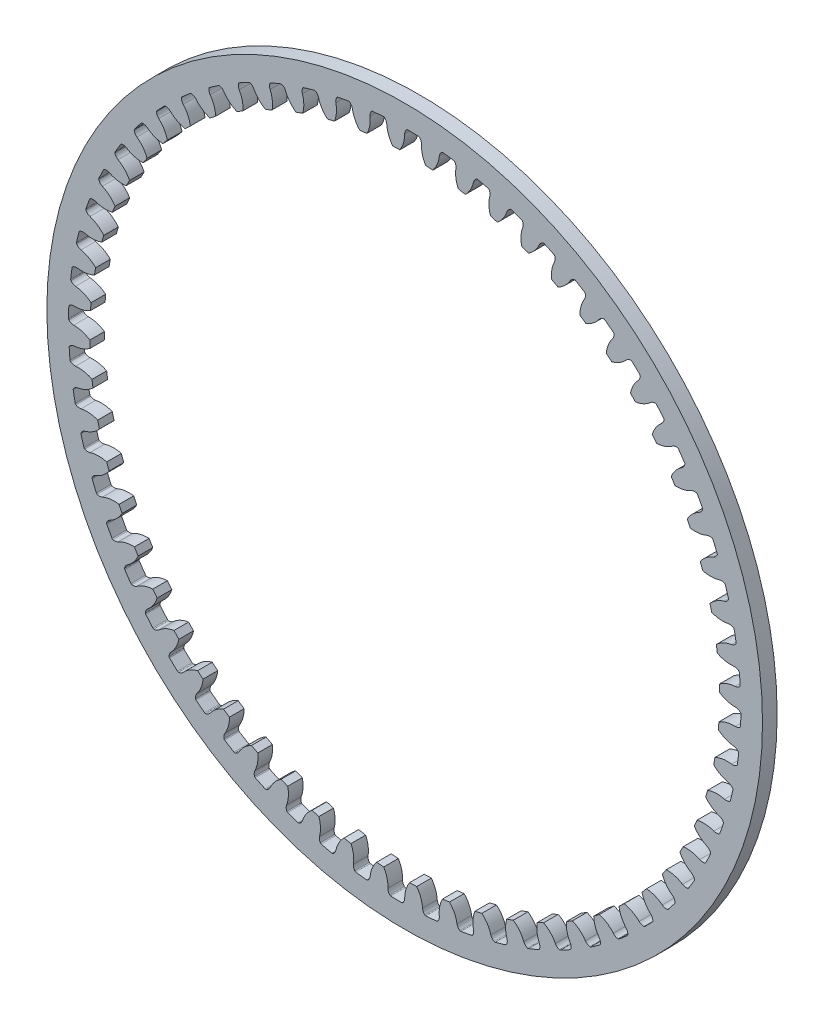
from build123d import *

# Parameters (mm, degrees)
BOSS_EXTRUDE1_DEPTH = 3
CHAMFER1_SIZE       = 0.5
FILLET2_R           = 1.4
FILLET3_R           = 0.3
CIRPATTERN1_DEPTH   = 3


# Read off the part's stored shape, not the designer's step: CirPattern1
with BuildPart() as part:
    # Sketch1 → Boss-Extrude1 (new body)
    with BuildSketch(Plane.XY):
        with BuildLine():
            Line((-7.093200614, 67.487306793), (-7.203054967, 68.532503961))
            ThreePointArc((-7.203054967, 68.532503961), (-5.465102965, 68.692945414), (-3.7236451, 68.809320351))
            Line((-3.7236451, 68.809320351), (-3.669087823, 67.801148418))
            ThreePointArc((-3.669087823, 67.801148418), (-3.311888955, 66.061957245), (-2.461340021, 64.503450435))
            Line((-2.461340021, 64.503450435), (-0.999634675, 64.542971937))
            ThreePointArc((-0.999634675, 64.542971937), (-0.255341962, 66.127311516), (0, 67.859045914))
            Line((0, 67.859045914), (0, 68.91))
            ThreePointArc((0, 68.91), (0.866615162, 68.90455049), (1.733093257, 68.88820282))
            Line((1.733093257, 68.88820282), (1.844759693, 73.326798387))
            ThreePointArc((1.844759693, 73.326798387), (-5.830083646, 73.117936409), (-13.441051368, 72.107979018))
            Line((-13.441051368, 72.107979018), (-12.627441714, 67.743160657))
            ThreePointArc((-12.627441714, 67.743160657), (-11.762567505, 67.898675287), (-10.895780524, 68.043148566))
            Line((-10.895780524, 68.043148566), (-10.736139102, 67.046202549))
            ThreePointArc((-10.736139102, 67.046202549), (-10.199101212, 65.353876174), (-9.190302449, 63.892813782))
            Line((-9.190302449, 63.892813782), (-7.740736018, 64.084908534))
            ThreePointArc((-7.740736018, 64.084908534), (-7.166128741, 65.738368542), (-7.093200614, 67.487306793))
        make_face()
    extrude(amount=BOSS_EXTRUDE1_DEPTH)

    # Chamfer1
    chamfer1_edges = [part.edges().sort_by_distance(p)[0] for p in [
        (-3.7236451, 68.809320351, 1.5),
        (-7.203054967, 68.532503961, 1.5),
        (-10.895780524, 68.043148566, 1.5),
        (0, 68.91, 1.5),
    ]]
    chamfer(chamfer1_edges, length=CHAMFER1_SIZE - 0.0004)  # a hair under: the kernel refuses the full size

    # Fillet2
    fillet2_edges = [part.edges().sort_by_distance(p)[0] for p in [
        (0, 68.4104, 1.5),
        (-3.696648719, 68.310450272, 1.5),
        (-7.150832686, 68.035640807, 1.5),
        (-10.81678572, 67.54983327, 1.5),
    ]]
    fillet(fillet2_edges, radius=FILLET2_R)

    # Fillet3
    fillet3_edges = [part.edges().sort_by_distance(p)[0] for p in [
        (-11.38880622, 67.962366004, 1.5),
        (0.499596717, 68.908188941, 1.5),
        (-4.222414028, 68.780515553, 1.5),
        (-6.706005784, 68.58292489, 1.5),
    ]]
    fillet(fillet3_edges, radius=FILLET3_R)

    # CirPattern1 outline → CirPattern1 (add)
    with BuildSketch(Plane.XY):
        with BuildLine():
            Line((1.844759693, 73.326798387), (1.733093257, 68.88820282))
            ThreePointArc((1.733093257, 68.88820282), (2.299511856, 68.871622205), (2.86577496, 68.850384413))
            ThreePointArc((2.86577496, 68.850384413), (2.980831386, 68.822186651), (3.076002513, 68.751649061))
            ThreePointArc((3.076002513, 68.751649061), (3.353485369, 68.289151249), (3.435535192, 67.756076407))
            ThreePointArc((3.435535192, 67.756076407), (3.618653485, 66.018512763), (4.294590654, 64.407373827))
            Line((4.294590654, 64.407373827), (5.752419325, 64.29388904))
            ThreePointArc((5.752419325, 64.29388904), (6.65368157, 65.780913241), (7.090699115, 67.463925503))
            ThreePointArc((7.090699115, 67.463925503), (7.25312204, 67.982028039), (7.600452429, 68.399368483))
            ThreePointArc((7.600452429, 68.399368483), (7.705424882, 68.454381137), (7.823510636, 68.464449033))
            ThreePointArc((7.823510636, 68.464449033), (8.936389306, 68.328098511), (10.046902252, 68.17365954))
            ThreePointArc((10.046902252, 68.17365954), (10.158380982, 68.133589535), (10.245657588, 68.05349018))
            ThreePointArc((10.245657588, 68.05349018), (10.4732759, 67.564521093), (10.499154515, 67.025790028))
            ThreePointArc((10.499154515, 67.025790028), (10.499644069, 65.278604195), (11.003467608, 63.605636647))
            Line((11.003467608, 63.605636647), (12.441448167, 63.34038888))
            ThreePointArc((12.441448167, 63.34038888), (13.493209118, 64.725059646), (14.103754874, 66.353171468))
            ThreePointArc((14.103754874, 66.353171468), (14.319444274, 66.851457878), (14.708495626, 67.230206223))
            ThreePointArc((14.708495626, 67.230206223), (14.818643464, 67.273944969), (14.937134782, 67.271614404))
            ThreePointArc((14.937134782, 67.271614404), (16.029664521, 67.019683343), (17.117950738, 66.750010206))
            ThreePointArc((17.117950738, 66.750010206), (17.224630261, 66.698507056), (17.30305608, 66.609723692))
            ThreePointArc((17.30305608, 66.609723692), (17.478316569, 66.099640638), (17.447740914, 65.561155642))
            ThreePointArc((17.447740914, 65.561155642), (17.265597838, 63.823489498), (17.591789537, 62.107022574))
            Line((17.591789537, 62.107022574), (18.994166341, 61.692918078))
            ThreePointArc((18.994166341, 61.692918078), (20.184903559, 62.960064275), (20.962289148, 64.515437624))
            ThreePointArc((20.962289148, 64.515437624), (21.228882316, 64.988448752), (21.65539266, 65.324455258))
            ThreePointArc((21.65539266, 65.324455258), (21.769508987, 65.356440753), (21.887107517, 65.341737232))
            ThreePointArc((21.887107517, 65.341737232), (22.947318251, 64.976985811), (24.001454157, 64.595033078))
            ThreePointArc((24.001454157, 64.595033078), (24.102165787, 64.532660967), (24.170881597, 64.436166149))
            ThreePointArc((24.170881597, 64.436166149), (24.291863513, 63.910557702), (24.205168131, 63.378218736))
            ThreePointArc((24.205168131, 63.378218736), (23.842386627, 61.669111322), (23.987370901, 59.927951325))
            Line((23.987370901, 59.927951325), (25.338780023, 59.369526888))
            ThreePointArc((25.338780023, 59.369526888), (26.655446714, 60.505265877), (27.591154063, 61.97085995))
            ThreePointArc((27.591154063, 61.97085995), (27.905729702, 62.413413258), (28.365025556, 62.702996719))
            ThreePointArc((28.365025556, 62.702996719), (28.481860196, 62.722878645), (28.597277643, 62.695963278))
            ThreePointArc((28.597277643, 62.695963278), (29.613553574, 62.22238781), (30.621989928, 61.732340251))
            ThreePointArc((30.621989928, 61.732340251), (30.71563014, 61.659782649), (30.773883068, 61.556633769))
            ThreePointArc((30.773883068, 61.556633769), (30.839261464, 61.021258549), (30.697396635, 60.500897778))
            ThreePointArc((30.697396635, 60.500897778), (30.157952716, 58.839073484), (30.120142804, 57.092296412))
            Line((30.120142804, 57.092296412), (31.405777144, 56.395670561))
            ThreePointArc((31.405777144, 56.395670561), (32.833948405, 57.387558385), (33.917726556, 58.747315543))
            ThreePointArc((33.917726556, 58.747315543), (34.276838568, 59.154562406), (34.763888318, 59.394549876))
            ThreePointArc((34.763888318, 59.394549876), (34.882161088, 59.402110294), (34.994132774, 59.36327797))
            ThreePointArc((34.994132774, 59.36327797), (35.955339275, 58.786067037), (36.907027344, 58.193293709))
            ThreePointArc((36.907027344, 58.193293709), (36.992570292, 58.111345453), (37.039722096, 58.002672457))
            ThreePointArc((37.039722096, 58.002672457), (37.048780125, 57.463396261), (36.853299751, 56.960715162))
            ThreePointArc((36.853299751, 56.960715162), (36.143102481, 55.364382361), (35.922910982, 53.631126963))
            Line((35.922910982, 53.631126963), (37.128685603, 52.803931684))
            ThreePointArc((37.128685603, 52.803931684), (38.652713382, 53.641101654), (39.872687422, 54.880124483))
            ThreePointArc((39.872687422, 54.880124483), (40.272400835, 55.247602986), (40.78186776, 55.435365376))
            ThreePointArc((40.78186776, 55.435365376), (40.900282967, 55.430521547), (41.007582247, 55.380197709))
            ThreePointArc((41.007582247, 55.380197709), (41.903188234, 54.705675353), (42.787701218, 54.016670802))
            ThreePointArc((42.787701218, 54.016670802), (42.864209593, 53.926229863), (42.899743696, 53.813223569))
            ThreePointArc((42.899743696, 53.813223569), (42.85238265, 53.275954649), (42.60542882, 52.796460366))
            ThreePointArc((42.60542882, 52.796460366), (41.732260347, 51.283107617), (41.332101297, 49.582362938))
            Line((41.332101297, 49.582362938), (42.444804783, 48.633661623))
            ThreePointArc((42.444804783, 48.633661623), (44.047992151, 49.306940817), (45.390796558, 50.411653871))
            ThreePointArc((45.390796558, 50.411653871), (45.826732496, 50.735337827), (46.353035241, 50.868817659))
            ThreePointArc((46.353035241, 50.868817659), (46.470295365, 50.851622571), (46.571746508, 50.790358605))
            ThreePointArc((46.571746508, 50.790358605), (47.391939439, 50.025915046), (48.199586335, 49.248228162))
            ThreePointArc((48.199586335, 49.248228162), (48.266221965, 49.150285293), (48.289749003, 49.034183652))
            ThreePointArc((48.289749003, 49.034183652), (48.186487266, 48.504808664), (47.890765331, 48.053755008))
            ThreePointArc((47.890765331, 48.053755008), (46.864191322, 46.639964225), (46.288447476, 44.990365002))
            Line((46.288447476, 44.990365002), (47.29588946, 43.930551285))
            ThreePointArc((47.29588946, 43.930551285), (48.960670999, 44.432563889), (50.41159301, 45.390864231))
            ThreePointArc((50.41159301, 45.390864231), (50.878974803, 45.667207356), (51.416346649, 45.744942558))
            ThreePointArc((51.416346649, 45.744942558), (51.531167112, 45.715584672), (51.62565873, 45.644051756))
            ThreePointArc((51.62565873, 45.644051756), (52.361452494, 44.798062377), (53.083384646, 43.940213638))
            ThreePointArc((53.083384646, 43.940213638), (53.139417401, 43.835842065), (53.150679669, 43.717917274))
            ThreePointArc((53.150679669, 43.717917274), (52.992649086, 43.202235884), (52.651399323, 42.78456429))
            ThreePointArc((52.651399323, 42.78456429), (51.482667946, 41.485823863), (50.73764863, 39.905442281))
            Line((50.73764863, 39.905442281), (51.628790781, 38.746128303))
            ThreePointArc((51.628790781, 38.746128303), (53.336927274, 39.071373335), (54.880070942, 39.872761023))
            ThreePointArc((54.880070942, 39.872761023), (55.373778312, 40.098735531), (55.916332097, 40.119874014))
            ThreePointArc((55.916332097, 40.119874014), (56.027454747, 40.078674929), (56.113951443, 39.997656849))
            ThreePointArc((56.113951443, 39.997656849), (56.757284438, 39.079390517), (57.385592117, 38.150778725))
            ThreePointArc((57.385592117, 38.150778725), (57.430408131, 38.041121817), (57.429282158, 37.922665729))
            ThreePointArc((57.429282158, 37.922665729), (57.21821369, 37.426328177), (56.835174659, 37.046615173))
            ThreePointArc((56.835174659, 37.046615173), (55.537090124, 35.877155848), (54.630956698, 34.383308203))
            Line((54.630956698, 34.383308203), (55.396035996, 33.137194992))
            ThreePointArc((55.396035996, 33.137194992), (57.128812354, 33.282109872), (58.747270082, 33.917805404))
            ThreePointArc((58.747270082, 33.917805404), (59.261893428, 34.090935629), (59.803684467, 34.055246241))
            ThreePointArc((59.803684467, 34.055246241), (59.909891979, 34.002657379), (59.987446199, 33.913041717))
            ThreePointArc((59.987446199, 33.913041717), (60.531270022, 32.932559111), (61.059069442, 31.94335829))
            ThreePointArc((61.059069442, 31.94335829), (61.092177677, 31.829617621), (61.078675895, 31.711928212))
            ThreePointArc((61.078675895, 31.711928212), (60.81688247, 31.240372104), (60.396251025, 30.902777452))
            ThreePointArc((60.396251025, 30.902777452), (58.983035915, 29.875410536), (57.925717252, 28.484462308))
            Line((57.925717252, 28.484462308), (58.556350879, 27.165203251))
            ThreePointArc((58.556350879, 27.165203251), (60.294782736, 27.128199352), (61.970822882, 27.591237187))
            ThreePointArc((61.970822882, 27.591237187), (62.500724303, 27.709626076), (63.035816924, 27.617499358))
            ThreePointArc((63.035816924, 27.617499358), (63.135945506, 27.554096874), (63.203707436, 27.456865559))
            ThreePointArc((63.203707436, 27.456865559), (63.642063756, 26.424909099), (64.063572157, 25.385957191))
            ThreePointArc((64.063572157, 25.385957191), (64.08460988, 25.269378776), (64.058880107, 25.15374534))
            ThreePointArc((64.058880107, 25.15374534), (63.749229611, 24.712137557), (63.29561413, 24.420360486))
            ThreePointArc((63.29561413, 24.420360486), (61.782751591, 23.546343603), (60.585830964, 22.273535846))
            Line((60.585830964, 22.273535846), (61.075109939, 20.895584268))
            ThreePointArc((61.075109939, 20.895584268), (62.800150473, 20.677067948), (64.51540955, 20.962375724))
            ThreePointArc((64.51540955, 20.962375724), (65.054782939, 21.024726429), (65.577314304, 20.877172249))
            ThreePointArc((65.577314304, 20.877172249), (65.670267088, 20.803650796), (65.727494418, 20.699869021))
            ThreePointArc((65.727494418, 20.699869021), (66.055580589, 19.627744982), (66.366179911, 18.550424903))
            ThreePointArc((66.366179911, 18.550424903), (66.374916636, 18.432286151), (66.337240896, 18.319975717))
            ThreePointArc((66.337240896, 18.319975717), (65.983126258, 17.913154155), (65.501496745, 17.670390951))
            ThreePointArc((65.501496745, 17.670390951), (63.905562183, 16.95929841), (62.582154071, 15.818574649))
            Line((62.582154071, 15.818574649), (62.92471746, 14.397028464))
            ThreePointArc((62.92471746, 14.397028464), (64.617466866, 13.999392883), (66.353152493, 14.103843889))
            ThreePointArc((66.353152493, 14.103843889), (66.896088731, 14.109472996), (67.400334072, 13.908107456))
            ThreePointArc((67.400334072, 13.908107456), (67.485092487, 13.825272566), (67.531158129, 13.716077491))
            ThreePointArc((67.531158129, 13.716077491), (67.745379499, 12.615532352), (67.941666682, 11.511647511))
            ThreePointArc((67.941666682, 11.511647511), (67.938006665, 11.393242626), (67.888797606, 11.285485579))
            ThreePointArc((67.888797606, 11.285485579), (67.494098296, 10.917907943), (66.989731537, 10.726818863))
            ThreePointArc((66.989731537, 10.726818863), (65.328210346, 10.186443155), (63.892813694, 9.190303092))
            Line((63.892813694, 9.190303092), (64.084908507, 7.740736243))
            ThreePointArc((64.084908507, 7.740736243), (65.726820669, 7.168338935), (67.463916042, 7.090789637))
            ThreePointArc((67.463916042, 7.090789637), (68.004466269, 7.039635796), (68.484900831, 6.786665649))
            ThreePointArc((68.484900831, 6.786665649), (68.560536403, 6.695424846), (68.594935735, 6.582012721))
            ThreePointArc((68.594935735, 6.582012721), (68.692945314, 5.465104214), (68.772769856, 4.346748933))
            ThreePointArc((68.772769856, 4.346748933), (68.756753236, 4.229375329), (68.696550149, 4.127352374))
            ThreePointArc((68.696550149, 4.127352374), (68.265590806, 3.803045412), (67.744012745, 3.665723573))
            ThreePointArc((67.744012745, 3.665723573), (66.03510873, 3.301983564), (64.503450455, 2.461339372))
            Line((64.503450455, 2.461339372), (64.542971941, 0.999634448))
            ThreePointArc((64.542971941, 0.999634448), (66.116057625, 0.258745767), (67.835530942, 4.4935e-05))
            ThreePointArc((67.835530942, 4.4935e-05), (68.367773077, -0.107331758), (68.819133198, -0.40913548))
            ThreePointArc((68.819133198, -0.40913548), (68.884817096, -0.507782494), (68.907173161, -0.62416898))
            ThreePointArc((68.907173161, -0.62416898), (68.88789708, -1.745203695), (68.850384353, -2.865776403))
            ThreePointArc((68.850384353, -2.865776403), (68.822186556, -2.980832897), (68.751648884, -3.076004056))
            ThreePointArc((68.751648884, -3.076004056), (68.289151013, -3.353486637), (67.756076224, -3.435536217))
            ThreePointArc((67.756076224, -3.435536217), (66.01851283, -3.618653739), (64.407373874, -4.294590007))
            Line((64.407373874, -4.294590007), (64.29388906, -5.752419099))
            ThreePointArc((64.29388906, -5.752419099), (65.78091341, -6.653680887), (67.463925676, -7.090697983))
            ThreePointArc((67.463925676, -7.090697983), (67.982028102, -7.253120701), (68.399368564, -7.600450806))
            ThreePointArc((68.399368564, -7.600450806), (68.454381288, -7.705423298), (68.464449206, -7.823509119))
            ThreePointArc((68.464449206, -7.823509119), (68.328098704, -8.936387833), (68.173659751, -10.046900823))
            ThreePointArc((68.173659751, -10.046900823), (68.133589788, -10.158379489), (68.053490518, -10.245656072))
            ThreePointArc((68.053490518, -10.245656072), (67.564521462, -10.473274664), (67.025790317, -10.499153514))
            ThreePointArc((67.025790317, -10.499153514), (65.278604154, -10.499643809), (63.605636532, -11.003468246))
            Line((63.605636532, -11.003468246), (63.340388836, -12.441448389))
            ThreePointArc((63.340388836, -12.441448389), (64.725059405, -13.49320978), (66.353171178, -14.103755982))
            ThreePointArc((66.353171178, -14.103755982), (66.851457676, -14.3194456), (67.230205973, -14.708497232))
            ThreePointArc((67.230205973, -14.708497232), (67.273944653, -14.818645022), (67.271614073, -14.937136272))
            ThreePointArc((67.271614073, -14.937136272), (67.019682997, -16.029665966), (66.750009847, -17.117952137))
            ThreePointArc((66.750009847, -17.117952137), (66.69850665, -17.22463172), (66.609723198, -17.303057553))
            ThreePointArc((66.609723198, -17.303057553), (66.099640142, -17.47831776), (65.56115525, -17.447741879))
            ThreePointArc((65.56115525, -17.447741879), (63.823489512, -17.265598101), (62.107022755, -17.591788915))
            Line((62.107022755, -17.591788915), (61.692918145, -18.994166124))
            ThreePointArc((61.692918145, -18.994166124), (62.960064583, -20.184902926), (64.515438029, -20.962288076))
            ThreePointArc((64.515438029, -20.962288076), (64.988449092, -21.22888102), (65.324455675, -21.655391089))
            ThreePointArc((65.324455675, -21.655391089), (65.356441231, -21.769507469), (65.341737717, -21.887106069))
            ThreePointArc((65.341737717, -21.887106069), (64.976986306, -22.94731685), (64.595033581, -24.001452803))
            ThreePointArc((64.595033581, -24.001452803), (64.532661524, -24.102164379), (64.436166794, -24.170880185))
            ThreePointArc((64.436166794, -24.170880185), (63.910558319, -24.29186238), (63.378219227, -24.205167213))
            ThreePointArc((63.378219227, -24.205167213), (61.669111336, -23.842386364), (59.927951079, -23.987371501))
            Line((59.927951079, -23.987371501), (59.369526799, -25.338780232))
            ThreePointArc((59.369526799, -25.338780232), (60.505265506, -26.655447312), (61.970859436, -27.591155086))
            ThreePointArc((61.970859436, -27.591155086), (62.413412785, -27.905730956), (62.702996141, -28.365027075))
            ThreePointArc((62.702996141, -28.365027075), (62.722878012, -28.481861655), (62.695962645, -28.597279032))
            ThreePointArc((62.695962645, -28.597279032), (62.222387171, -29.613554915), (61.732339609, -30.621991222))
            ThreePointArc((61.732339609, -30.621991222), (61.659781947, -30.715631482), (61.556632979, -30.773884405))
            ThreePointArc((61.556632979, -30.773884405), (61.021257816, -30.839262526), (60.500897194, -30.697397497))
            ThreePointArc((60.500897194, -30.697397497), (58.839073442, -30.157952975), (57.092296719, -30.120142232))
            Line((57.092296719, -30.120142232), (56.395670671, -31.405776945))
            ThreePointArc((56.395670671, -31.405776945), (57.387558817, -32.83394785), (58.747316161, -33.917725592))
            ThreePointArc((58.747316161, -33.917725592), (59.154563008, -34.27683737), (59.394550611, -34.763886868))
            ThreePointArc((59.394550611, -34.763886868), (59.402111076, -34.882159703), (59.363278746, -34.994131459))
            ThreePointArc((59.363278746, -34.994131459), (58.786067812, -35.955338007), (58.193294482, -36.907026124))
            ThreePointArc((58.193294482, -36.907026124), (58.11134629, -36.99256903), (58.002673382, -37.039720848))
            ThreePointArc((58.002673382, -37.039720848), (57.4633971, -37.048779146), (56.960715834, -36.853298955))
            ThreePointArc((56.960715834, -36.853298955), (55.36438243, -36.143102227), (53.631126598, -35.922911518))
            Line((53.631126598, -35.922911518), (52.803931554, -37.128685789))
            ThreePointArc((52.803931554, -37.128685789), (53.641101166, -38.652713889), (54.880123767, -39.872688316))
            ThreePointArc((54.880123767, -39.872688316), (55.247602263, -40.272401964), (55.435364495, -40.781869126))
            ThreePointArc((55.435364495, -40.781869126), (55.430520624, -40.900284263), (55.3801968, -41.007583474))
            ThreePointArc((55.3801968, -41.007583474), (54.70567445, -41.903189413), (54.016669905, -42.78770235))
            ThreePointArc((54.016669905, -42.78770235), (53.926228897, -42.86421076), (53.813222518, -42.89974484))
            ThreePointArc((53.813222518, -42.89974484), (53.275953711, -42.852383537), (52.796459615, -42.605429542))
            ThreePointArc((52.796459615, -42.605429542), (51.283107522, -41.732260592), (49.582363357, -41.332100802))
            Line((49.582363357, -41.332100802), (48.633661772, -42.444804612))
            ThreePointArc((48.633661772, -42.444804612), (49.306941355, -44.047991698), (50.411654676, -45.390795744))
            ThreePointArc((50.411654676, -45.390795744), (50.735338665, -45.826731449), (50.868818678, -46.353033975))
            ThreePointArc((50.868818678, -46.353033975), (50.851623624, -46.470294173), (50.790359637, -46.571745383))
            ThreePointArc((50.790359637, -46.571745383), (50.025916068, -47.391938361), (49.248229172, -48.199585303))
            ThreePointArc((49.248229172, -48.199585303), (49.150286375, -48.266220905), (49.034184816, -48.289747975))
            ThreePointArc((49.034184816, -48.289747975), (48.504809689, -48.186486483), (48.053755831, -47.890764691))
            ThreePointArc((48.053755831, -47.890764691), (46.639964345, -46.864191089), (44.990364534, -46.288447924))
            Line((44.990364534, -46.288447924), (43.930551119, -47.295889614))
            ThreePointArc((43.930551119, -47.295889614), (44.432563307, -48.960671393), (45.390863345, -50.411593735))
            ThreePointArc((45.390863345, -50.411593735), (45.667206414, -50.878975756), (45.744941412, -51.416347802))
            ThreePointArc((45.744941412, -51.416347802), (45.7155835, -51.531168187), (45.644050612, -51.625659741))
            ThreePointArc((45.644050612, -51.625659741), (44.798061248, -52.36145346), (43.940212525, -53.083385567))
            ThreePointArc((43.940212525, -53.083385567), (43.835840878, -53.139418341), (43.717916009, -53.15068057))
            ThreePointArc((43.717916009, -53.15068057), (43.202234783, -52.992649758), (42.784563406, -52.651399872))
            ThreePointArc((42.784563406, -52.651399872), (41.48582372, -51.482668166), (39.905442793, -50.737648233))
            Line((39.905442793, -50.737648233), (38.746128484, -51.628790645))
            ThreePointArc((38.746128484, -51.628790645), (39.071373955, -53.336926943), (39.87276198, -54.880070313))
            ThreePointArc((39.87276198, -54.880070313), (40.098736567, -55.373777462), (40.119875274, -55.916331071))
            ThreePointArc((40.119875274, -55.916331071), (40.078676207, -56.0274538), (39.997658092, -56.113950557))
            ThreePointArc((39.997658092, -56.113950557), (39.079391741, -56.757283596), (38.150779928, -57.385591318))
            ThreePointArc((38.150779928, -57.385591318), (38.041123095, -57.430407319), (37.922667081, -57.429281394))
            ThreePointArc((37.922667081, -57.429281394), (37.426329342, -57.218213136), (37.046616111, -56.835174205))
            ThreePointArc((37.046616111, -56.835174205), (35.877156014, -55.53708992), (34.383307651, -54.63095704))
            Line((34.383307651, -54.63095704), (33.137194797, -55.396036112))
            ThreePointArc((33.137194797, -55.396036112), (33.28210922, -57.128812618), (33.917804386, -58.747270607))
            ThreePointArc((33.917804386, -58.747270607), (34.09093451, -59.261894164), (34.05524488, -59.803685356))
            ThreePointArc((34.05524488, -59.803685356), (34.002656009, -59.909892788), (33.913040387, -59.987446951))
            ThreePointArc((33.913040387, -59.987446951), (32.932557805, -60.531270732), (31.94335701, -61.059070112))
            ThreePointArc((31.94335701, -61.059070112), (31.829616265, -61.09217835), (31.711926788, -61.078676513))
            ThreePointArc((31.711926788, -61.078676513), (31.240370887, -60.816882898), (30.902776472, -60.396251379))
            ThreePointArc((30.902776472, -60.396251379), (29.875410349, -58.9830361), (28.484462892, -57.92571697))
            Line((28.484462892, -57.92571697), (27.165203457, -58.556350784))
            ThreePointArc((27.165203457, -58.556350784), (27.128200028, -60.294782541), (27.591238254, -61.970822466))
            ThreePointArc((27.591238254, -61.970822466), (27.709627267, -62.500723687), (27.617500804, -63.035816182))
            ThreePointArc((27.617500804, -63.035816182), (27.554098321, -63.135944845), (27.456866959, -63.203706828))
            ThreePointArc((27.456866959, -63.203706828), (26.42491047, -63.642063186), (25.385958533, -64.063571625))
            ThreePointArc((25.385958533, -64.063571625), (25.269380195, -64.084609352), (25.153746822, -64.058879641))
            ThreePointArc((25.153746822, -64.058879641), (24.712138811, -63.749229312), (24.420361497, -63.295613881))
            ThreePointArc((24.420361497, -63.295613881), (23.546343808, -61.782751426), (22.273535235, -60.585831184))
            Line((22.273535235, -60.585831184), (20.895584053, -61.075110013))
            ThreePointArc((20.895584053, -61.075110013), (20.677067255, -62.800150597), (20.96237462, -64.515409853))
            ThreePointArc((20.96237462, -64.515409853), (21.02472518, -65.054783427), (20.877170733, -65.57731489))
            ThreePointArc((20.877170733, -65.57731489), (20.803649288, -65.670267593), (20.699867565, -65.727494877))
            ThreePointArc((20.699867565, -65.727494877), (19.627743558, -66.055581012), (18.550423512, -66.366180299))
            ThreePointArc((18.550423512, -66.366180299), (18.432284685, -66.374917013), (18.319974195, -66.337241205))
            ThreePointArc((18.319974195, -66.337241205), (17.913152876, -65.983126424), (17.670389919, -65.501496887))
            ThreePointArc((17.670389919, -65.501496887), (16.959298189, -63.905562326), (15.818575279, -62.582153917))
            Line((15.818575279, -62.582153917), (14.397028685, -62.924717409))
            ThreePointArc((14.397028685, -62.924717409), (13.999393584, -64.617466816), (14.103845019, -66.353152307))
            ThreePointArc((14.103845019, -66.353152307), (14.109474289, -66.896088376), (13.908109025, -67.400333647))
            ThreePointArc((13.908109025, -67.400333647), (13.825274119, -67.485092141), (13.716078987, -67.531157825))
            ThreePointArc((13.716078987, -67.531157825), (12.615533812, -67.745379227), (11.511648935, -67.941666441))
            ThreePointArc((11.511648935, -67.941666441), (11.393244124, -67.938006444), (11.285487125, -67.888797459))
            ThreePointArc((11.285487125, -67.888797459), (10.917909233, -67.494098264), (10.726819904, -66.989731503))
            ThreePointArc((10.726819904, -66.989731503), (10.186443389, -65.328210227), (9.190302449, -63.892813782))
            Line((9.190302449, -63.892813782), (7.740736018, -64.084908534))
            ThreePointArc((7.740736018, -64.084908534), (7.168338232, -65.726820646), (7.090788493, -67.463916109))
            ThreePointArc((7.090788493, -67.463916109), (7.039634473, -68.004466487), (6.786664044, -68.484901089))
            ThreePointArc((6.786664044, -68.484901089), (6.695423265, -68.560536585), (6.582011201, -68.594935881))
            ThreePointArc((6.582011201, -68.594935881), (5.465102733, -68.692945432), (4.346747492, -68.772769947))
            ThreePointArc((4.346747492, -68.772769947), (4.229373817, -68.756753299), (4.127350821, -68.696550134))
            ThreePointArc((4.127350821, -68.696550134), (3.803044127, -68.265590702), (3.665722535, -67.74401267))
            ThreePointArc((3.665722535, -67.74401267), (3.301983318, -66.035108824), (2.461340021, -64.503450435))
            Line((2.461340021, -64.503450435), (0.999634675, -64.542971937))
            ThreePointArc((0.999634675, -64.542971937), (0.258746464, -66.116057722), (4.6079e-05, -67.835530996))
            ThreePointArc((4.6079e-05, -67.835530996), (-0.10733042, -68.367773), (-0.409133857, -68.819133109))
            ThreePointArc((-0.409133857, -68.819133109), (-0.507780904, -68.884817081), (-0.624167454, -68.907173175))
            ThreePointArc((-0.624167454, -68.907173175), (-1.74520221, -68.887897117), (-2.86577496, -68.850384413))
            ThreePointArc((-2.86577496, -68.850384413), (-2.980831386, -68.822186651), (-3.076002513, -68.751649061))
            ThreePointArc((-3.076002513, -68.751649061), (-3.353485369, -68.289151249), (-3.435535192, -67.756076407))
            ThreePointArc((-3.435535192, -67.756076407), (-3.618653485, -66.018512763), (-4.294590654, -64.407373827))
            Line((-4.294590654, -64.407373827), (-5.752419325, -64.29388904))
            ThreePointArc((-5.752419325, -64.29388904), (-6.65368157, -65.780913241), (-7.090699115, -67.463925503))
            ThreePointArc((-7.090699115, -67.463925503), (-7.25312204, -67.982028039), (-7.600452429, -68.399368483))
            ThreePointArc((-7.600452429, -68.399368483), (-7.705424882, -68.454381137), (-7.823510636, -68.464449033))
            ThreePointArc((-7.823510636, -68.464449033), (-8.936389306, -68.328098511), (-10.046902252, -68.17365954))
            ThreePointArc((-10.046902252, -68.17365954), (-10.158380982, -68.133589535), (-10.245657588, -68.05349018))
            ThreePointArc((-10.245657588, -68.05349018), (-10.4732759, -67.564521093), (-10.499154515, -67.025790028))
            ThreePointArc((-10.499154515, -67.025790028), (-10.499644069, -65.278604195), (-11.003467608, -63.605636647))
            Line((-11.003467608, -63.605636647), (-12.441448167, -63.34038888))
            ThreePointArc((-12.441448167, -63.34038888), (-13.493209118, -64.725059646), (-14.103754874, -66.353171468))
            ThreePointArc((-14.103754874, -66.353171468), (-14.319444274, -66.851457878), (-14.708495626, -67.230206223))
            ThreePointArc((-14.708495626, -67.230206223), (-14.818643464, -67.273944969), (-14.937134782, -67.271614404))
            ThreePointArc((-14.937134782, -67.271614404), (-16.029664521, -67.019683343), (-17.117950738, -66.750010206))
            ThreePointArc((-17.117950738, -66.750010206), (-17.224630261, -66.698507056), (-17.30305608, -66.609723692))
            ThreePointArc((-17.30305608, -66.609723692), (-17.478316569, -66.099640638), (-17.447740914, -65.561155642))
            ThreePointArc((-17.447740914, -65.561155642), (-17.265597838, -63.823489498), (-17.591789537, -62.107022574))
            Line((-17.591789537, -62.107022574), (-18.994166341, -61.692918078))
            ThreePointArc((-18.994166341, -61.692918078), (-20.184903559, -62.960064275), (-20.962289148, -64.515437624))
            ThreePointArc((-20.962289148, -64.515437624), (-21.228882316, -64.988448752), (-21.65539266, -65.324455258))
            ThreePointArc((-21.65539266, -65.324455258), (-21.769508987, -65.356440753), (-21.887107517, -65.341737232))
            ThreePointArc((-21.887107517, -65.341737232), (-22.947318251, -64.976985811), (-24.001454157, -64.595033078))
            ThreePointArc((-24.001454157, -64.595033078), (-24.102165787, -64.532660967), (-24.170881597, -64.436166149))
            ThreePointArc((-24.170881597, -64.436166149), (-24.291863513, -63.910557702), (-24.205168131, -63.378218736))
            ThreePointArc((-24.205168131, -63.378218736), (-23.842386627, -61.669111322), (-23.987370901, -59.927951325))
            Line((-23.987370901, -59.927951325), (-25.338780023, -59.369526888))
            ThreePointArc((-25.338780023, -59.369526888), (-26.655446714, -60.505265877), (-27.591154063, -61.97085995))
            ThreePointArc((-27.591154063, -61.97085995), (-27.905729702, -62.413413258), (-28.365025556, -62.702996719))
            ThreePointArc((-28.365025556, -62.702996719), (-28.481860196, -62.722878645), (-28.597277643, -62.695963278))
            ThreePointArc((-28.597277643, -62.695963278), (-29.613553574, -62.22238781), (-30.621989928, -61.732340251))
            ThreePointArc((-30.621989928, -61.732340251), (-30.71563014, -61.659782649), (-30.773883068, -61.556633769))
            ThreePointArc((-30.773883068, -61.556633769), (-30.839261464, -61.021258549), (-30.697396635, -60.500897778))
            ThreePointArc((-30.697396635, -60.500897778), (-30.157952716, -58.839073484), (-30.120142804, -57.092296412))
            Line((-30.120142804, -57.092296412), (-31.405777144, -56.395670561))
            ThreePointArc((-31.405777144, -56.395670561), (-32.833948405, -57.387558385), (-33.917726556, -58.747315543))
            ThreePointArc((-33.917726556, -58.747315543), (-34.276838568, -59.154562406), (-34.763888318, -59.394549876))
            ThreePointArc((-34.763888318, -59.394549876), (-34.882161088, -59.402110294), (-34.994132774, -59.36327797))
            ThreePointArc((-34.994132774, -59.36327797), (-35.955339275, -58.786067037), (-36.907027344, -58.193293709))
            ThreePointArc((-36.907027344, -58.193293709), (-36.992570292, -58.111345453), (-37.039722096, -58.002672457))
            ThreePointArc((-37.039722096, -58.002672457), (-37.048780125, -57.463396261), (-36.853299751, -56.960715162))
            ThreePointArc((-36.853299751, -56.960715162), (-36.143102481, -55.364382361), (-35.922910982, -53.631126963))
            Line((-35.922910982, -53.631126963), (-37.128685603, -52.803931684))
            ThreePointArc((-37.128685603, -52.803931684), (-38.652713382, -53.641101654), (-39.872687422, -54.880124483))
            ThreePointArc((-39.872687422, -54.880124483), (-40.272400835, -55.247602986), (-40.78186776, -55.435365376))
            ThreePointArc((-40.78186776, -55.435365376), (-40.900282967, -55.430521547), (-41.007582247, -55.380197709))
            ThreePointArc((-41.007582247, -55.380197709), (-41.903188234, -54.705675353), (-42.787701218, -54.016670802))
            ThreePointArc((-42.787701218, -54.016670802), (-42.864209593, -53.926229863), (-42.899743696, -53.813223569))
            ThreePointArc((-42.899743696, -53.813223569), (-42.85238265, -53.275954649), (-42.60542882, -52.796460366))
            ThreePointArc((-42.60542882, -52.796460366), (-41.732260347, -51.283107617), (-41.332101297, -49.582362938))
            Line((-41.332101297, -49.582362938), (-42.444804783, -48.633661623))
            ThreePointArc((-42.444804783, -48.633661623), (-44.047992151, -49.306940817), (-45.390796558, -50.411653871))
            ThreePointArc((-45.390796558, -50.411653871), (-45.826732496, -50.735337827), (-46.353035241, -50.868817659))
            ThreePointArc((-46.353035241, -50.868817659), (-46.470295365, -50.851622571), (-46.571746508, -50.790358605))
            ThreePointArc((-46.571746508, -50.790358605), (-47.391939439, -50.025915046), (-48.199586335, -49.248228162))
            ThreePointArc((-48.199586335, -49.248228162), (-48.266221965, -49.150285293), (-48.289749003, -49.034183652))
            ThreePointArc((-48.289749003, -49.034183652), (-48.186487266, -48.504808664), (-47.890765331, -48.053755008))
            ThreePointArc((-47.890765331, -48.053755008), (-46.864191322, -46.639964225), (-46.288447476, -44.990365002))
            Line((-46.288447476, -44.990365002), (-47.29588946, -43.930551285))
            ThreePointArc((-47.29588946, -43.930551285), (-48.960670999, -44.432563889), (-50.41159301, -45.390864231))
            ThreePointArc((-50.41159301, -45.390864231), (-50.878974803, -45.667207356), (-51.416346649, -45.744942558))
            ThreePointArc((-51.416346649, -45.744942558), (-51.531167112, -45.715584672), (-51.62565873, -45.644051756))
            ThreePointArc((-51.62565873, -45.644051756), (-52.361452494, -44.798062377), (-53.083384646, -43.940213638))
            ThreePointArc((-53.083384646, -43.940213638), (-53.139417401, -43.835842065), (-53.150679669, -43.717917274))
            ThreePointArc((-53.150679669, -43.717917274), (-52.992649086, -43.202235884), (-52.651399323, -42.78456429))
            ThreePointArc((-52.651399323, -42.78456429), (-51.482667946, -41.485823863), (-50.73764863, -39.905442281))
            Line((-50.73764863, -39.905442281), (-51.628790781, -38.746128303))
            ThreePointArc((-51.628790781, -38.746128303), (-53.336927274, -39.071373335), (-54.880070942, -39.872761023))
            ThreePointArc((-54.880070942, -39.872761023), (-55.373778312, -40.098735531), (-55.916332097, -40.119874014))
            ThreePointArc((-55.916332097, -40.119874014), (-56.027454747, -40.078674929), (-56.113951443, -39.997656849))
            ThreePointArc((-56.113951443, -39.997656849), (-56.757284438, -39.079390517), (-57.385592117, -38.150778725))
            ThreePointArc((-57.385592117, -38.150778725), (-57.430408131, -38.041121817), (-57.429282158, -37.922665729))
            ThreePointArc((-57.429282158, -37.922665729), (-57.21821369, -37.426328177), (-56.835174659, -37.046615173))
            ThreePointArc((-56.835174659, -37.046615173), (-55.537090124, -35.877155848), (-54.630956698, -34.383308203))
            Line((-54.630956698, -34.383308203), (-55.396035996, -33.137194992))
            ThreePointArc((-55.396035996, -33.137194992), (-57.128812354, -33.282109872), (-58.747270082, -33.917805404))
            ThreePointArc((-58.747270082, -33.917805404), (-59.261893428, -34.090935629), (-59.803684467, -34.055246241))
            ThreePointArc((-59.803684467, -34.055246241), (-59.909891979, -34.002657379), (-59.987446199, -33.913041717))
            ThreePointArc((-59.987446199, -33.913041717), (-60.531270022, -32.932559111), (-61.059069442, -31.94335829))
            ThreePointArc((-61.059069442, -31.94335829), (-61.092177677, -31.829617621), (-61.078675895, -31.711928212))
            ThreePointArc((-61.078675895, -31.711928212), (-60.81688247, -31.240372104), (-60.396251025, -30.902777452))
            ThreePointArc((-60.396251025, -30.902777452), (-58.983035915, -29.875410536), (-57.925717252, -28.484462308))
            Line((-57.925717252, -28.484462308), (-58.556350879, -27.165203251))
            ThreePointArc((-58.556350879, -27.165203251), (-60.294782736, -27.128199352), (-61.970822882, -27.591237187))
            ThreePointArc((-61.970822882, -27.591237187), (-62.500724303, -27.709626076), (-63.035816924, -27.617499358))
            ThreePointArc((-63.035816924, -27.617499358), (-63.135945506, -27.554096874), (-63.203707436, -27.456865559))
            ThreePointArc((-63.203707436, -27.456865559), (-63.642063756, -26.424909099), (-64.063572157, -25.385957191))
            ThreePointArc((-64.063572157, -25.385957191), (-64.08460988, -25.269378776), (-64.058880107, -25.15374534))
            ThreePointArc((-64.058880107, -25.15374534), (-63.749229611, -24.712137557), (-63.29561413, -24.420360486))
            ThreePointArc((-63.29561413, -24.420360486), (-61.782751591, -23.546343603), (-60.585830964, -22.273535846))
            Line((-60.585830964, -22.273535846), (-61.075109939, -20.895584268))
            ThreePointArc((-61.075109939, -20.895584268), (-62.800150473, -20.677067948), (-64.51540955, -20.962375724))
            ThreePointArc((-64.51540955, -20.962375724), (-65.054782939, -21.024726429), (-65.577314304, -20.877172249))
            ThreePointArc((-65.577314304, -20.877172249), (-65.670267088, -20.803650796), (-65.727494418, -20.699869021))
            ThreePointArc((-65.727494418, -20.699869021), (-66.055580589, -19.627744982), (-66.366179911, -18.550424903))
            ThreePointArc((-66.366179911, -18.550424903), (-66.374916636, -18.432286151), (-66.337240896, -18.319975717))
            ThreePointArc((-66.337240896, -18.319975717), (-65.983126258, -17.913154155), (-65.501496745, -17.670390951))
            ThreePointArc((-65.501496745, -17.670390951), (-63.905562183, -16.95929841), (-62.582154071, -15.818574649))
            Line((-62.582154071, -15.818574649), (-62.92471746, -14.397028464))
            ThreePointArc((-62.92471746, -14.397028464), (-64.617466866, -13.999392883), (-66.353152493, -14.103843889))
            ThreePointArc((-66.353152493, -14.103843889), (-66.896088731, -14.109472996), (-67.400334072, -13.908107456))
            ThreePointArc((-67.400334072, -13.908107456), (-67.485092487, -13.825272566), (-67.531158129, -13.716077491))
            ThreePointArc((-67.531158129, -13.716077491), (-67.745379499, -12.615532352), (-67.941666682, -11.511647511))
            ThreePointArc((-67.941666682, -11.511647511), (-67.938006665, -11.393242626), (-67.888797606, -11.285485579))
            ThreePointArc((-67.888797606, -11.285485579), (-67.494098296, -10.917907943), (-66.989731537, -10.726818863))
            ThreePointArc((-66.989731537, -10.726818863), (-65.328210346, -10.186443155), (-63.892813694, -9.190303092))
            Line((-63.892813694, -9.190303092), (-64.084908507, -7.740736243))
            ThreePointArc((-64.084908507, -7.740736243), (-65.726820669, -7.168338935), (-67.463916042, -7.090789637))
            ThreePointArc((-67.463916042, -7.090789637), (-68.004466269, -7.039635796), (-68.484900831, -6.786665649))
            ThreePointArc((-68.484900831, -6.786665649), (-68.560536403, -6.695424846), (-68.594935735, -6.582012721))
            ThreePointArc((-68.594935735, -6.582012721), (-68.692945314, -5.465104214), (-68.772769856, -4.346748933))
            ThreePointArc((-68.772769856, -4.346748933), (-68.756753236, -4.229375329), (-68.696550149, -4.127352374))
            ThreePointArc((-68.696550149, -4.127352374), (-68.265590806, -3.803045412), (-67.744012745, -3.665723573))
            ThreePointArc((-67.744012745, -3.665723573), (-66.03510873, -3.301983564), (-64.503450455, -2.461339372))
            Line((-64.503450455, -2.461339372), (-64.542971941, -0.999634448))
            ThreePointArc((-64.542971941, -0.999634448), (-66.116057625, -0.258745767), (-67.835530942, -4.4935e-05))
            ThreePointArc((-67.835530942, -4.4935e-05), (-68.367773077, 0.107331758), (-68.819133198, 0.40913548))
            ThreePointArc((-68.819133198, 0.40913548), (-68.884817096, 0.507782494), (-68.907173161, 0.62416898))
            ThreePointArc((-68.907173161, 0.62416898), (-68.88789708, 1.745203695), (-68.850384353, 2.865776403))
            ThreePointArc((-68.850384353, 2.865776403), (-68.822186556, 2.980832897), (-68.751648884, 3.076004056))
            ThreePointArc((-68.751648884, 3.076004056), (-68.289151013, 3.353486637), (-67.756076224, 3.435536217))
            ThreePointArc((-67.756076224, 3.435536217), (-66.01851283, 3.618653739), (-64.407373874, 4.294590007))
            Line((-64.407373874, 4.294590007), (-64.29388906, 5.752419099))
            ThreePointArc((-64.29388906, 5.752419099), (-65.78091341, 6.653680887), (-67.463925676, 7.090697983))
            ThreePointArc((-67.463925676, 7.090697983), (-67.982028102, 7.253120701), (-68.399368564, 7.600450806))
            ThreePointArc((-68.399368564, 7.600450806), (-68.454381288, 7.705423298), (-68.464449206, 7.823509119))
            ThreePointArc((-68.464449206, 7.823509119), (-68.328098704, 8.936387833), (-68.173659751, 10.046900823))
            ThreePointArc((-68.173659751, 10.046900823), (-68.133589788, 10.158379489), (-68.053490518, 10.245656072))
            ThreePointArc((-68.053490518, 10.245656072), (-67.564521462, 10.473274664), (-67.025790317, 10.499153514))
            ThreePointArc((-67.025790317, 10.499153514), (-65.278604154, 10.499643809), (-63.605636532, 11.003468246))
            Line((-63.605636532, 11.003468246), (-63.340388836, 12.441448389))
            ThreePointArc((-63.340388836, 12.441448389), (-64.725059405, 13.49320978), (-66.353171178, 14.103755982))
            ThreePointArc((-66.353171178, 14.103755982), (-66.851457676, 14.3194456), (-67.230205973, 14.708497232))
            ThreePointArc((-67.230205973, 14.708497232), (-67.273944653, 14.818645022), (-67.271614073, 14.937136272))
            ThreePointArc((-67.271614073, 14.937136272), (-67.019682997, 16.029665966), (-66.750009847, 17.117952137))
            ThreePointArc((-66.750009847, 17.117952137), (-66.69850665, 17.22463172), (-66.609723198, 17.303057553))
            ThreePointArc((-66.609723198, 17.303057553), (-66.099640142, 17.47831776), (-65.56115525, 17.447741879))
            ThreePointArc((-65.56115525, 17.447741879), (-63.823489512, 17.265598101), (-62.107022755, 17.591788915))
            Line((-62.107022755, 17.591788915), (-61.692918145, 18.994166124))
            ThreePointArc((-61.692918145, 18.994166124), (-62.960064583, 20.184902926), (-64.515438029, 20.962288076))
            ThreePointArc((-64.515438029, 20.962288076), (-64.988449092, 21.22888102), (-65.324455675, 21.655391089))
            ThreePointArc((-65.324455675, 21.655391089), (-65.356441231, 21.769507469), (-65.341737717, 21.887106069))
            ThreePointArc((-65.341737717, 21.887106069), (-64.976986306, 22.94731685), (-64.595033581, 24.001452803))
            ThreePointArc((-64.595033581, 24.001452803), (-64.532661524, 24.102164379), (-64.436166794, 24.170880185))
            ThreePointArc((-64.436166794, 24.170880185), (-63.910558319, 24.29186238), (-63.378219227, 24.205167213))
            ThreePointArc((-63.378219227, 24.205167213), (-61.669111336, 23.842386364), (-59.927951079, 23.987371501))
            Line((-59.927951079, 23.987371501), (-59.369526799, 25.338780232))
            ThreePointArc((-59.369526799, 25.338780232), (-60.505265506, 26.655447312), (-61.970859436, 27.591155086))
            ThreePointArc((-61.970859436, 27.591155086), (-62.413412785, 27.905730956), (-62.702996141, 28.365027075))
            ThreePointArc((-62.702996141, 28.365027075), (-62.722878012, 28.481861655), (-62.695962645, 28.597279032))
            ThreePointArc((-62.695962645, 28.597279032), (-62.222387171, 29.613554915), (-61.732339609, 30.621991222))
            ThreePointArc((-61.732339609, 30.621991222), (-61.659781947, 30.715631482), (-61.556632979, 30.773884405))
            ThreePointArc((-61.556632979, 30.773884405), (-61.021257816, 30.839262526), (-60.500897194, 30.697397497))
            ThreePointArc((-60.500897194, 30.697397497), (-58.839073442, 30.157952975), (-57.092296719, 30.120142232))
            Line((-57.092296719, 30.120142232), (-56.395670671, 31.405776945))
            ThreePointArc((-56.395670671, 31.405776945), (-57.387558817, 32.83394785), (-58.747316161, 33.917725592))
            ThreePointArc((-58.747316161, 33.917725592), (-59.154563008, 34.27683737), (-59.394550611, 34.763886868))
            ThreePointArc((-59.394550611, 34.763886868), (-59.402111076, 34.882159703), (-59.363278746, 34.994131459))
            ThreePointArc((-59.363278746, 34.994131459), (-58.786067812, 35.955338007), (-58.193294482, 36.907026124))
            ThreePointArc((-58.193294482, 36.907026124), (-58.11134629, 36.99256903), (-58.002673382, 37.039720848))
            ThreePointArc((-58.002673382, 37.039720848), (-57.4633971, 37.048779146), (-56.960715834, 36.853298955))
            ThreePointArc((-56.960715834, 36.853298955), (-55.36438243, 36.143102227), (-53.631126598, 35.922911518))
            Line((-53.631126598, 35.922911518), (-52.803931554, 37.128685789))
            ThreePointArc((-52.803931554, 37.128685789), (-53.641101166, 38.652713889), (-54.880123767, 39.872688316))
            ThreePointArc((-54.880123767, 39.872688316), (-55.247602263, 40.272401964), (-55.435364495, 40.781869126))
            ThreePointArc((-55.435364495, 40.781869126), (-55.430520624, 40.900284263), (-55.3801968, 41.007583474))
            ThreePointArc((-55.3801968, 41.007583474), (-54.70567445, 41.903189413), (-54.016669905, 42.78770235))
            ThreePointArc((-54.016669905, 42.78770235), (-53.926228897, 42.86421076), (-53.813222518, 42.89974484))
            ThreePointArc((-53.813222518, 42.89974484), (-53.275953711, 42.852383537), (-52.796459615, 42.605429542))
            ThreePointArc((-52.796459615, 42.605429542), (-51.283107522, 41.732260592), (-49.582363357, 41.332100802))
            Line((-49.582363357, 41.332100802), (-48.633661772, 42.444804612))
            ThreePointArc((-48.633661772, 42.444804612), (-49.306941355, 44.047991698), (-50.411654676, 45.390795744))
            ThreePointArc((-50.411654676, 45.390795744), (-50.735338665, 45.826731449), (-50.868818678, 46.353033975))
            ThreePointArc((-50.868818678, 46.353033975), (-50.851623624, 46.470294173), (-50.790359637, 46.571745383))
            ThreePointArc((-50.790359637, 46.571745383), (-50.025916068, 47.391938361), (-49.248229172, 48.199585303))
            ThreePointArc((-49.248229172, 48.199585303), (-49.150286375, 48.266220905), (-49.034184816, 48.289747975))
            ThreePointArc((-49.034184816, 48.289747975), (-48.504809689, 48.186486483), (-48.053755831, 47.890764691))
            ThreePointArc((-48.053755831, 47.890764691), (-46.639964345, 46.864191089), (-44.990364534, 46.288447924))
            Line((-44.990364534, 46.288447924), (-43.930551119, 47.295889614))
            ThreePointArc((-43.930551119, 47.295889614), (-44.432563307, 48.960671393), (-45.390863345, 50.411593735))
            ThreePointArc((-45.390863345, 50.411593735), (-45.667206414, 50.878975756), (-45.744941412, 51.416347802))
            ThreePointArc((-45.744941412, 51.416347802), (-45.7155835, 51.531168187), (-45.644050612, 51.625659741))
            ThreePointArc((-45.644050612, 51.625659741), (-44.798061248, 52.36145346), (-43.940212525, 53.083385567))
            ThreePointArc((-43.940212525, 53.083385567), (-43.835840878, 53.139418341), (-43.717916009, 53.15068057))
            ThreePointArc((-43.717916009, 53.15068057), (-43.202234783, 52.992649758), (-42.784563406, 52.651399872))
            ThreePointArc((-42.784563406, 52.651399872), (-41.48582372, 51.482668166), (-39.905442793, 50.737648233))
            Line((-39.905442793, 50.737648233), (-38.746128484, 51.628790645))
            ThreePointArc((-38.746128484, 51.628790645), (-39.071373955, 53.336926943), (-39.87276198, 54.880070313))
            ThreePointArc((-39.87276198, 54.880070313), (-40.098736567, 55.373777462), (-40.119875274, 55.916331071))
            ThreePointArc((-40.119875274, 55.916331071), (-40.078676207, 56.0274538), (-39.997658092, 56.113950557))
            ThreePointArc((-39.997658092, 56.113950557), (-39.079391741, 56.757283596), (-38.150779928, 57.385591318))
            ThreePointArc((-38.150779928, 57.385591318), (-38.041123095, 57.430407319), (-37.922667081, 57.429281394))
            ThreePointArc((-37.922667081, 57.429281394), (-37.426329342, 57.218213136), (-37.046616111, 56.835174205))
            ThreePointArc((-37.046616111, 56.835174205), (-35.877156014, 55.53708992), (-34.383307651, 54.63095704))
            Line((-34.383307651, 54.63095704), (-33.137194797, 55.396036112))
            ThreePointArc((-33.137194797, 55.396036112), (-33.28210922, 57.128812618), (-33.917804386, 58.747270607))
            ThreePointArc((-33.917804386, 58.747270607), (-34.09093451, 59.261894164), (-34.05524488, 59.803685356))
            ThreePointArc((-34.05524488, 59.803685356), (-34.002656009, 59.909892788), (-33.913040387, 59.987446951))
            ThreePointArc((-33.913040387, 59.987446951), (-32.932557805, 60.531270732), (-31.94335701, 61.059070112))
            ThreePointArc((-31.94335701, 61.059070112), (-31.829616265, 61.09217835), (-31.711926788, 61.078676513))
            ThreePointArc((-31.711926788, 61.078676513), (-31.240370887, 60.816882898), (-30.902776472, 60.396251379))
            ThreePointArc((-30.902776472, 60.396251379), (-29.875410349, 58.9830361), (-28.484462892, 57.92571697))
            Line((-28.484462892, 57.92571697), (-27.165203457, 58.556350784))
            ThreePointArc((-27.165203457, 58.556350784), (-27.128200028, 60.294782541), (-27.591238254, 61.970822466))
            ThreePointArc((-27.591238254, 61.970822466), (-27.709627267, 62.500723687), (-27.617500804, 63.035816182))
            ThreePointArc((-27.617500804, 63.035816182), (-27.554098321, 63.135944845), (-27.456866959, 63.203706828))
            ThreePointArc((-27.456866959, 63.203706828), (-26.42491047, 63.642063186), (-25.385958533, 64.063571625))
            ThreePointArc((-25.385958533, 64.063571625), (-25.269380195, 64.084609352), (-25.153746822, 64.058879641))
            ThreePointArc((-25.153746822, 64.058879641), (-24.712138811, 63.749229312), (-24.420361497, 63.295613881))
            ThreePointArc((-24.420361497, 63.295613881), (-23.546343808, 61.782751426), (-22.273535235, 60.585831184))
            Line((-22.273535235, 60.585831184), (-20.895584053, 61.075110013))
            ThreePointArc((-20.895584053, 61.075110013), (-20.677067255, 62.800150597), (-20.96237462, 64.515409853))
            ThreePointArc((-20.96237462, 64.515409853), (-21.02472518, 65.054783427), (-20.877170733, 65.57731489))
            ThreePointArc((-20.877170733, 65.57731489), (-20.803649288, 65.670267593), (-20.699867565, 65.727494877))
            ThreePointArc((-20.699867565, 65.727494877), (-19.627743558, 66.055581012), (-18.550423512, 66.366180299))
            ThreePointArc((-18.550423512, 66.366180299), (-18.432284685, 66.374917013), (-18.319974195, 66.337241205))
            ThreePointArc((-18.319974195, 66.337241205), (-17.913152876, 65.983126424), (-17.670389919, 65.501496887))
            ThreePointArc((-17.670389919, 65.501496887), (-16.959298189, 63.905562326), (-15.818575279, 62.582153917))
            Line((-15.818575279, 62.582153917), (-14.397028685, 62.924717409))
            ThreePointArc((-14.397028685, 62.924717409), (-13.999393584, 64.617466816), (-14.103845019, 66.353152307))
            ThreePointArc((-14.103845019, 66.353152307), (-14.109474289, 66.896088376), (-13.908109025, 67.400333647))
            ThreePointArc((-13.908109025, 67.400333647), (-13.825274119, 67.485092141), (-13.716078987, 67.531157825))
            ThreePointArc((-13.716078987, 67.531157825), (-13.172186873, 67.639349442), (-12.627441714, 67.743160657))
            Line((-12.627441714, 67.743160657), (-13.441051368, 72.107979018))
            ThreePointArc((-13.441051368, 72.107979018), (5.830083646, -73.117936409), (1.844759693, 73.326798387))
        make_face()
    extrude(amount=CIRPATTERN1_DEPTH)


solid = part.part
